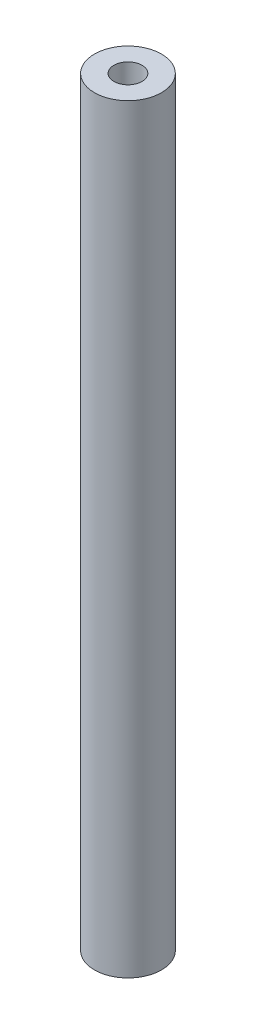
from build123d import *

# Parameters (mm, degrees)
CROQUIS1_R              = 4.7625
SALIENTE_EXTRUIR1_DEPTH = 108
CROQUIS2_R              = 2
CORTAR_EXTRUIR1_DEPTH   = 10


with BuildPart() as part:
    # Croquis1 → Saliente-Extruir1 (new body)
    with BuildSketch(Plane(origin=(0, 0, 0), x_dir=(1, 0, 0), z_dir=(0, 1, 0))):
        Circle(CROQUIS1_R)
    extrude(amount=SALIENTE_EXTRUIR1_DEPTH)

    # Croquis2 → Cortar-Extruir1 (cut)
    with BuildSketch(Plane.XZ):
        Circle(CROQUIS2_R)
    cortar_extruir1 = extrude(amount=-CORTAR_EXTRUIR1_DEPTH, mode=Mode.SUBTRACT)

    # Simetría1: Cortar-Extruir1 across plane
    add(cortar_extruir1.mirror(Plane(origin=(0, 54, 0), x_dir=(0, 0, 1), z_dir=(0, -1, 0))), mode=Mode.SUBTRACT)


solid = part.part
